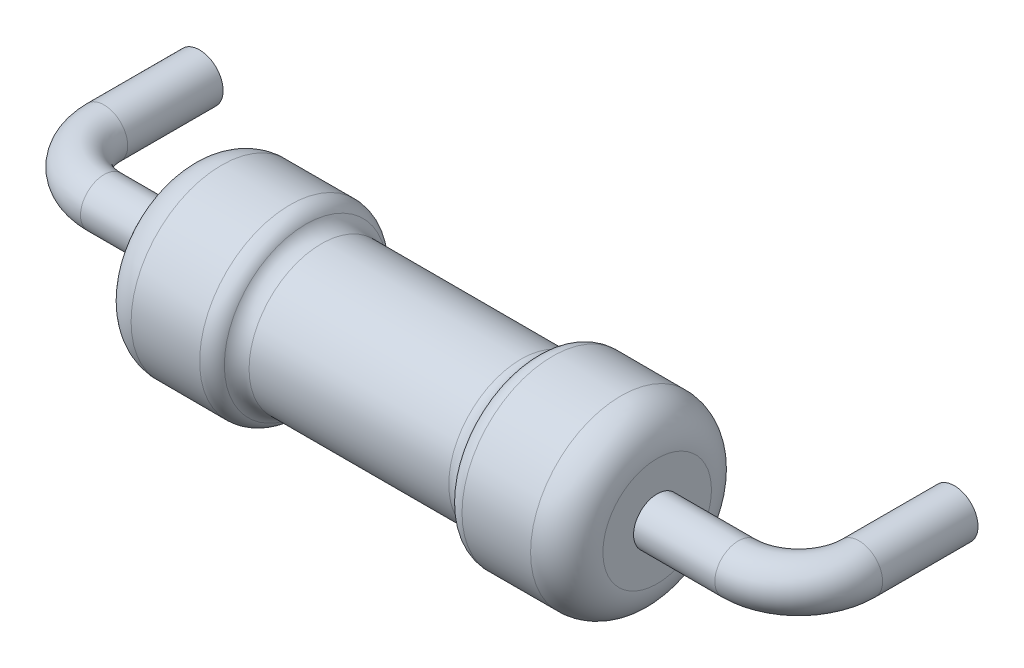
from build123d import *

# Parameters (mm, degrees)
EXTRUDE_START   = -1.5
SKETCH_3_R      = 0.92
EXTRUDE_1_DEPTH = 3
SKETCH_5_R      = 1.15
EXTRUDE_2_DEPTH = 1.5
EXTRUDE_START_2 = 1.5
SKETCH_7_R      = 1.15
EXTRUDE_3_DEPTH = 1.5
FILLET_1_R      = 0.46
FILLET_3_R      = 0.23
FILLET_4_R      = 0.23
SKETCH_1_R      = 0.3
SKETCH_32_R     = 0.3
EXTRUDE_4_DEPTH = 0.6


with BuildPart() as part:
    # Эскиз3 → Бобышка-Вытянуть1 (new body)
    with BuildSketch(Plane(origin=(0, 0, 0), x_dir=(0, 0, -1), z_dir=(1, 0, 0)).offset(EXTRUDE_START)):
        with Locations((-1.38, 0)):
            Circle(SKETCH_3_R)
    extrude(amount=EXTRUDE_1_DEPTH)

    # Эскиз5 → Бобышка-Вытянуть2 (add)
    with BuildSketch(Plane.ZY.offset(1.5)):
        with Locations((1.38, 0)):
            Circle(SKETCH_5_R)
    extrude(amount=EXTRUDE_2_DEPTH)

    # Эскиз7 → Бобышка-Вытянуть3 (add)
    with BuildSketch(Plane(origin=(1.5, 0, 0), x_dir=(0, 0, -1), z_dir=(1, 0, 0)).offset(EXTRUDE_START_2)):
        with Locations(Location((-1.38, 0, 0), (0, 0, 180))):
            Circle(SKETCH_7_R)
    extrude(amount=-EXTRUDE_3_DEPTH)

    # Скругление1
    fillet_1_edges = [part.edges().sort_by_distance(p)[0] for p in [
        (3, 0, 0.23),
        (-3, 0, 0.23),
    ]]
    fillet(fillet_1_edges, radius=FILLET_1_R)

    # Скругление3
    fillet_3_edges = [part.edges().sort_by_distance(p)[0] for p in [
        (1.5, 0, 2.3),
        (-1.5, 0, 2.3),
    ]]
    fillet(fillet_3_edges, radius=FILLET_3_R - 0.0001)  # a hair under: the kernel refuses the full size

    # Скругление4
    fillet_4_edges = [part.edges().sort_by_distance(p)[0] for p in [
        (-1.5, 0, 0.23),
        (1.5, 0, 0.23),
    ]]
    fillet(fillet_4_edges, radius=FILLET_4_R)


with BuildPart() as body_2:
    # По траектории8: sweep along a path in Эскиз10
    with BuildLine(Plane(origin=(0, 0, 0), x_dir=(1, 0, 0), z_dir=(0, 1, 0))) as sweep_8_path:
        Line((-4.8, 0), (-4.8, -0.613333333))
        ThreePointArc((-4.8, -0.613333333), (-4.575448532, -1.155448532), (-4.033333333, -1.38))
        Line((-4.033333333, -1.38), (-3, -1.38))
    # Эскиз1 → По траектории8 (sweep)
    with BuildSketch(Plane.XY):
        with Locations((-4.8, 0)):
            Circle(SKETCH_1_R)
    sweep(path=sweep_8_path.line)


with BuildPart() as body_3:
    # Зеркальное отражение1: mirrored copy
    add(body_2.part.mirror(Plane(origin=(0, 0, 0), x_dir=(0, 0, 1), z_dir=(1, 0, 0))))


with BuildPart() as body_2_1:
    add(body_2.part)

    add(body_3.part)  # Бобышка-Вытянуть4 merges body 3
    # Эскиз32 → Бобышка-Вытянуть4 (add)
    with BuildSketch(Plane(origin=(0, 0, 0), x_dir=(-1, 0, 0), z_dir=(0, 0, -1))):
        with Locations((4.8, 0)):
            Circle(SKETCH_32_R)
        with Locations(Location((-4.8, 0, 0), (0, 0, 180))):
            Circle(SKETCH_32_R)
    extrude(amount=EXTRUDE_4_DEPTH)


solid = Compound([part.part, body_2_1.part])
